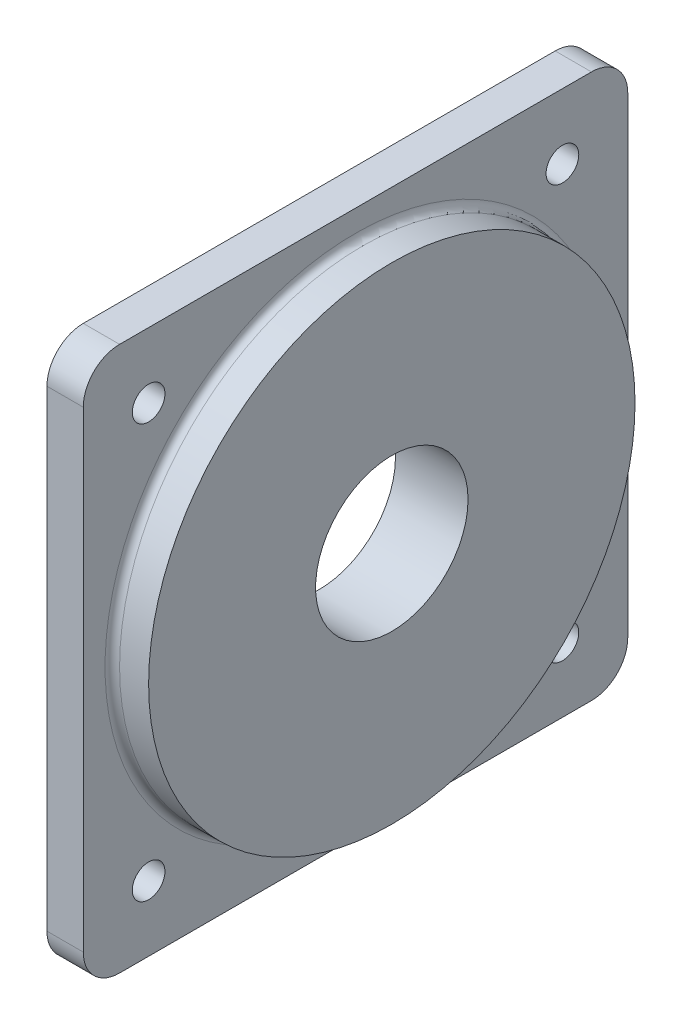
from build123d import *

# Parameters (mm, degrees)
CROQUIS1_W                   = 150
CROQUIS1_H                   = 150
SALIENTE_EXTRUIR1_DEPTH      = 10
CROQUIS2_R                   = 67
SALIENTE_EXTRUIR2_DEPTH      = 10
REDONDEO1_R                  = 10
REDONDEO2_R                  = 2
CROQUIS3_R                   = 21
CORTAR_EXTRUIR1_DEPTH        = 108.935165725
TALADRO_DE_MARGEN_PARA_M81_D = 9
TALADRO_DE_MARGEN_PARA_M82_D = 9


with BuildPart() as part:
    # Croquis1 → Saliente-Extruir1 (new body)
    with BuildSketch(Plane(origin=(0, 0, 0), x_dir=(0, 0, -1), z_dir=(1, 0, 0))):
        Rectangle(CROQUIS1_W, CROQUIS1_H)
    extrude(amount=SALIENTE_EXTRUIR1_DEPTH)

    # Croquis2 → Saliente-Extruir2 (add)
    with BuildSketch(Plane(origin=(10, 0, 0), x_dir=(0, 0, -1), z_dir=(1, 0, 0))):
        Circle(CROQUIS2_R)
    extrude(amount=SALIENTE_EXTRUIR2_DEPTH)

    # Redondeo1
    redondeo1_edges = [part.edges().sort_by_distance(p)[0] for p in [
        (5, -75, 75),
        (5, -75, -75),
        (5, 75, -75),
        (5, 75, 75),
    ]]
    fillet(redondeo1_edges, radius=REDONDEO1_R)

    # Redondeo2
    redondeo2_edges = [part.edges().sort_by_distance(p)[0] for p in [
        (10, 0, 67),
    ]]
    fillet(redondeo2_edges, radius=REDONDEO2_R)

    # Croquis3 → Cortar-Extruir1 (cut, through all)
    with BuildSketch(Plane(origin=(20, 0, 0), x_dir=(0, 0, -1), z_dir=(1, 0, 0))):
        Circle(CROQUIS3_R)
    extrude(amount=-CORTAR_EXTRUIR1_DEPTH, mode=Mode.SUBTRACT)

    # Taladro de margen para M81 (through all)
    with Locations(Plane(origin=(10, -7.41730184, 252.760845032), x_dir=(0, 0, -1), z_dir=(1, 0, 0))):
        with Locations((195.760845032, 64.41730184), (309.760845032, 64.41730184)):
            Hole(TALADRO_DE_MARGEN_PARA_M81_D / 2)

    # Taladro de margen para M82 (through all)
    with Locations(Plane(origin=(10, -7.41730184, 252.760845032), x_dir=(0, 0, -1), z_dir=(1, 0, 0))):
        with Locations((309.760845032, -49.58269816), (195.760845032, -49.58269816)):
            Hole(TALADRO_DE_MARGEN_PARA_M82_D / 2)


solid = part.part
